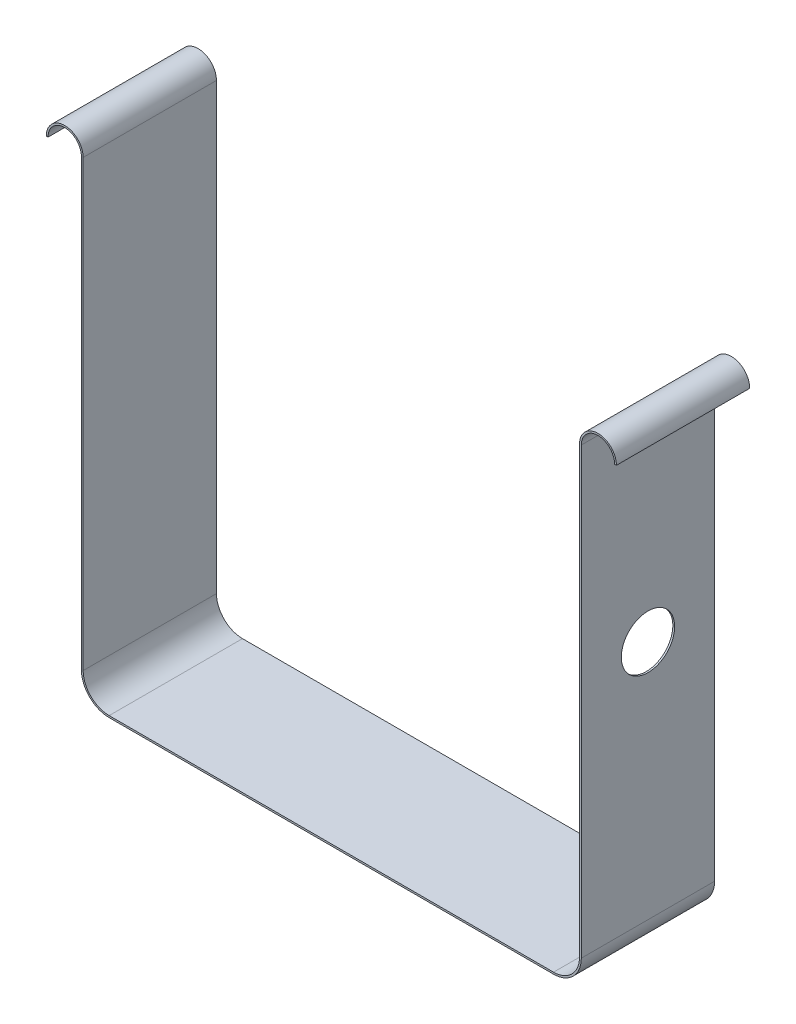
from build123d import *

# Parameters (mm, degrees)
STOCK_ROPE_START                        = -38.1
STOCK_ROPE_ROBOT_CHASSIS_MASTER_1_DEPTH = 76.2
CUT_EXTRUDE1_REACH                      = 392.081
SKETCH1_R                               = 15.24


# Read off the part's stored shape, not the designer's step: Stock-Rope Robot Chassis Master-1
with BuildPart() as part:
    # Stock-Rope Robot Chassis Master-1 outlin → Stock-Rope Robot Chassis Master-1 (new body)
    with BuildSketch(Plane.XY.offset(STOCK_ROPE_START)):
        with BuildLine():
            ThreePointArc((-127, -40.259), (-137.506899662, -35.906899662), (-141.859, -25.4))
            Line((-141.859, -25.4), (-141.859, 228.6))
            ThreePointArc((-141.859, 228.6), (-152.4, 239.141), (-162.941, 228.6))
            Line((-162.941, 228.6), (-161.925, 228.6))
            ThreePointArc((-161.925, 228.6), (-152.4, 238.125), (-142.875, 228.6))
            Line((-142.875, 228.6), (-142.875, -25.4))
            ThreePointArc((-142.875, -25.4), (-138.225320151, -36.625320151), (-127, -41.275))
            Line((-127, -41.275), (127, -41.275))
            ThreePointArc((127, -41.275), (138.225320151, -36.625320151), (142.875, -25.4))
            Line((142.875, -25.4), (142.875, 228.6))
            ThreePointArc((142.875, 228.6), (152.4, 238.125), (161.925, 228.6))
            Line((161.925, 228.6), (162.941, 228.6))
            ThreePointArc((162.941, 228.6), (152.4, 239.141), (141.859, 228.6))
            Line((141.859, 228.6), (141.859, -25.4))
            ThreePointArc((141.859, -25.4), (137.506899662, -35.906899662), (127, -40.259))
            Line((127, -40.259), (-127, -40.259))
        make_face()
    extrude(amount=STOCK_ROPE_ROBOT_CHASSIS_MASTER_1_DEPTH)

    # Sketch1 → Cut-Extrude1 (cut, up to next)
    with BuildSketch(Plane(origin=(142.875, 0, 0), x_dir=(0, 0, -1), z_dir=(1, 0, 0)), mode=Mode.PRIVATE) as cut_extrude1_sk1:
        with Locations(Location((0, 112.141, 0), (0, 0, 90))):
            Circle(SKETCH1_R)
    cut_extrude1_tool1 = extrude(cut_extrude1_sk1.sketch, amount=-CUT_EXTRUDE1_REACH, mode=Mode.PRIVATE) & part.part
    add(cut_extrude1_tool1.solids().sort_by_distance((142.875, 112.141, 0))[0], mode=Mode.SUBTRACT)


solid = part.part
